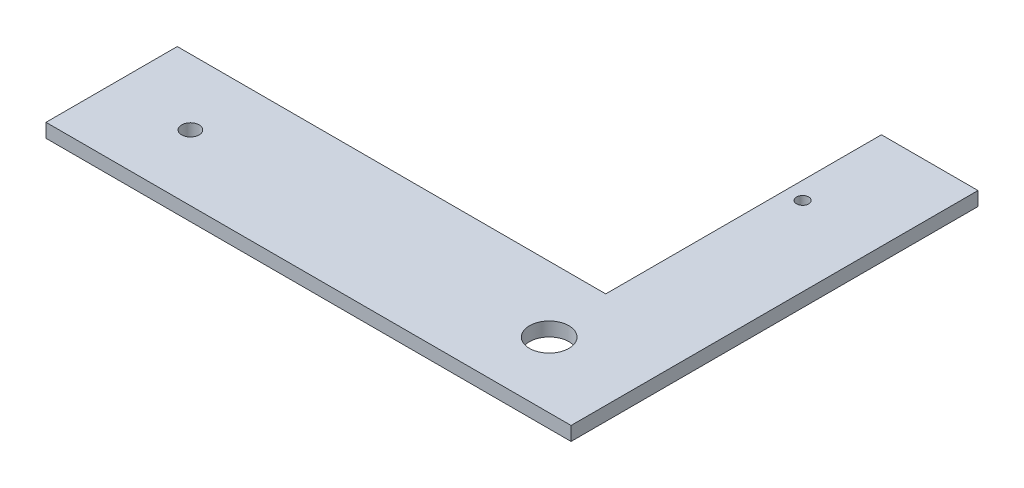
from build123d import *

# Parameters (mm, degrees)
SKETCH1_W           = 120
SKETCH1_H           = 30
BOSS_EXTRUDE1_DEPTH = 3.175
SKETCH2_R           = 2
SKETCH2_R_2         = 4.5
CUT_EXTRUDE1_DEPTH  = 3.175
SKETCH3_W           = 22.072613883
SKETCH3_H           = 3.175
BOSS_EXTRUDE2_DEPTH = 63
SKETCH4_R           = 1.381817411
CUT_EXTRUDE2_DEPTH  = 10


with BuildPart() as part:
    # Sketch1 → Boss-Extrude1 (new body)
    with BuildSketch(Plane(origin=(0, 0, 0), x_dir=(1, 0, 0), z_dir=(0, 1, 0))):
        with Locations((60, 15)):
            Rectangle(SKETCH1_W, SKETCH1_H)
    extrude(amount=BOSS_EXTRUDE1_DEPTH)

    # Sketch2 → Cut-Extrude1 (cut)
    with BuildSketch(Plane(origin=(0, 3.175, 0), x_dir=(1, 0, 0), z_dir=(0, 1, 0))):
        with Locations((18, 15)):
            Circle(SKETCH2_R)
        with Locations((100, 15)):
            Circle(SKETCH2_R_2)
    extrude(amount=-CUT_EXTRUDE1_DEPTH, mode=Mode.SUBTRACT)

    # Sketch3 → Boss-Extrude2 (add)
    with BuildSketch(Plane(origin=(0, 0, -30), x_dir=(-1, 0, 0), z_dir=(0, 0, -1))):
        with Locations((-108.963693059, 1.5875)):
            Rectangle(SKETCH3_W, SKETCH3_H)
    extrude(amount=BOSS_EXTRUDE2_DEPTH)

    # Sketch4 → Cut-Extrude2 (cut)
    with BuildSketch(Plane(origin=(0, 3.175, 0), x_dir=(1, 0, 0), z_dir=(0, 1, 0))):
        with Locations((101.927386117, 71)):
            Circle(SKETCH4_R)
    extrude(amount=-CUT_EXTRUDE2_DEPTH, mode=Mode.SUBTRACT)


solid = part.part
